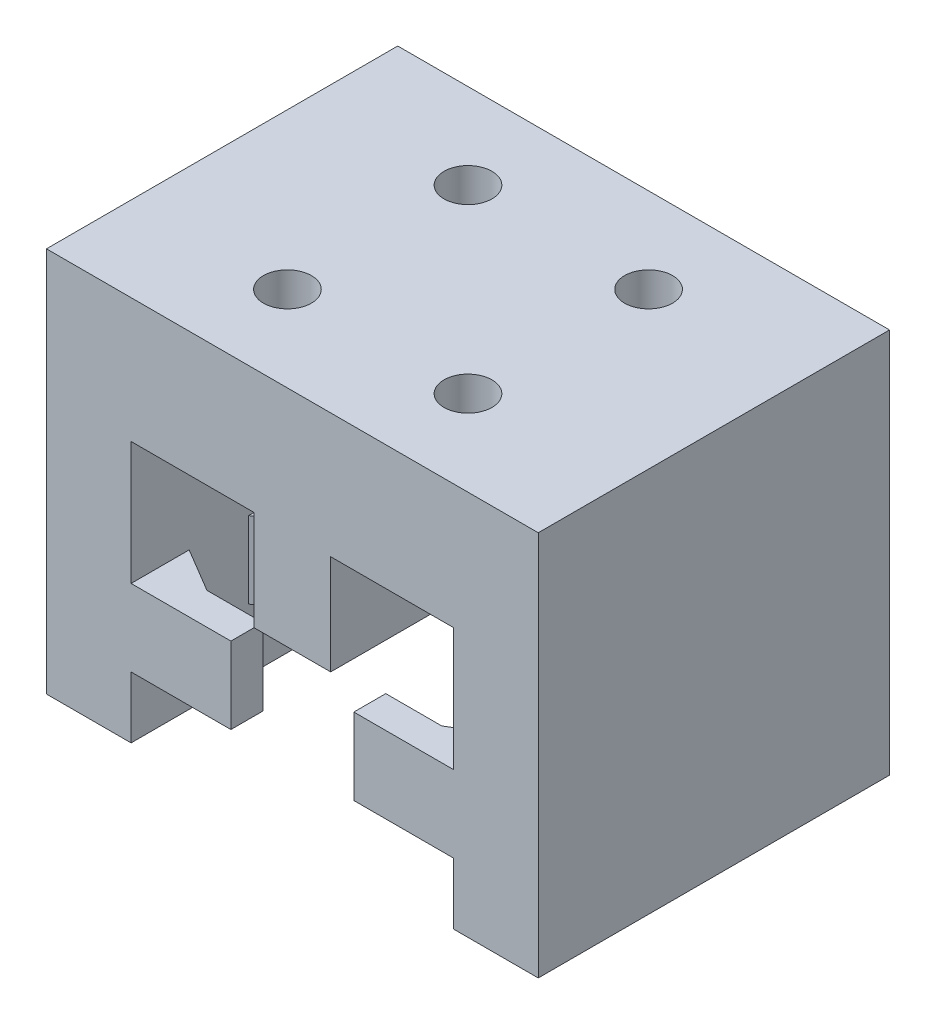
from build123d import *

# Parameters (mm, degrees)
ESQUISSE1_W                   = 30.8
ESQUISSE1_H                   = 24.15
BOSS_EXTRU_1_DEPTH            = 22
ENL_V_START                   = -22
ENL_V_MAT_EXTRU_2_DEPTH       = 22
ESQUISSE3_R                   = 1.5
ENL_V_MAT_EXTRU_3_DEPTH       = 4.4
ESQUISSE6_R                   = 3.2
ENL_V_MAT_EXTRU_6_DEPTH       = 3.4
ESQUISSE7_R                   = 3.2
ENL_V_MAT_EXTRU_7_DEPTH       = 3.4
ESQUISSE10_R                  = 3.2
ENL_V_MAT_EXTRU_10_DEPTH      = 3.4
ESQUISSE11_R                  = 3.2
ENL_V_MAT_EXTRU_11_DEPTH      = 3.4
ENL_V_MAT_EXTRU_14_DEPTH      = 47.950397903
ENL_V_MAT_EXTRU_14_DEPTH_BACK = 4.8
ENL_V_MAT_EXTRU_19_DEPTH      = 4.8
ENL_V_MAT_EXTRU_20_DEPTH      = 4.8
ENL_V_MAT_EXTRU_21_DEPTH      = 4.8


# Read off the part's stored shape, not the designer's step: Enlèv. mat.-Extru.2
with BuildPart() as part:
    # Esquisse1 → Boss.-Extru.1 (new body)
    with BuildSketch(Plane.XY):
        with Locations((-20.769736842, 6.111184211)):
            Rectangle(ESQUISSE1_W, ESQUISSE1_H)
    extrude(amount=BOSS_EXTRU_1_DEPTH)

    # Enlèv. mat.-Extru.2 outline → Enlèv. mat.-Extru.2 (cut)
    with BuildSketch(Plane.XY.offset(22).offset(ENL_V_START)):
        Polygon((-30.869736842, -5.963815789), (-10.669736842, -5.963815789), (-10.669736842, -2.113815789), (-16.919736842, -2.113815789), (-16.919736842, 2.686184211), (-10.669736842, 2.686184211), (-10.669736842, 10.386184211), (-18.369736842, 10.386184211), (-18.369736842, 4.136184211), (-23.169736842, 4.136184211), (-23.169736842, 10.386184211), (-30.869736842, 10.386184211), (-30.869736842, 2.686184211), (-24.619736842, 2.686184211), (-24.619736842, -2.113815789), (-30.869736842, -2.113815789), align=None)
    extrude(amount=ENL_V_MAT_EXTRU_2_DEPTH, mode=Mode.SUBTRACT)

    # Esquisse3 → Enlèv. mat.-Extru.3 (cut)
    with BuildSketch(Plane(origin=(0, 18.186184211, 0), x_dir=(1, 0, 0), z_dir=(0, 1, 0))):
        with Locations(Location((-26.424736842, -5.345, 0), (0, 0, 270))):
            Circle(ESQUISSE3_R)
        with Locations(Location((-15.114736842, -5.345, 0), (0, 0, 270))):
            Circle(ESQUISSE3_R)
        with Locations(Location((-26.424736842, -16.655, 0), (0, 0, 270))):
            Circle(ESQUISSE3_R)
        with Locations(Location((-15.114736842, -16.655, 0), (0, 0, 270))):
            Circle(ESQUISSE3_R)
    extrude(amount=-ENL_V_MAT_EXTRU_3_DEPTH, mode=Mode.SUBTRACT)

    # Esquisse6 → Enlèv. mat.-Extru.6 (cut)
    with BuildSketch(Plane(origin=(0, 13.786184211, 0), x_dir=(1, 0, 0), z_dir=(0, 1, 0))):
        with Locations(Location((-15.126255276, -16.627264665, 0), (0, 0, 270))):
            Circle(ESQUISSE6_R)
    extrude(amount=-ENL_V_MAT_EXTRU_6_DEPTH, mode=Mode.SUBTRACT)

    # Esquisse7 → Enlèv. mat.-Extru.7 (cut)
    with BuildSketch(Plane(origin=(0, 13.786184211, 0), x_dir=(1, 0, 0), z_dir=(0, 1, 0))):
        with Locations(Location((-26.44565221, -16.692132269, 0), (0, 0, 270))):
            Circle(ESQUISSE7_R)
    extrude(amount=-ENL_V_MAT_EXTRU_7_DEPTH, mode=Mode.SUBTRACT)

    # Esquisse10 → Enlèv. mat.-Extru.10 (cut)
    with BuildSketch(Plane(origin=(0, 13.786184211, 0), x_dir=(1, 0, 0), z_dir=(0, 1, 0))):
        with Locations(Location((-15.114736842, -5.345, 0), (0, 0, 270))):
            Circle(ESQUISSE10_R)
    extrude(amount=-ENL_V_MAT_EXTRU_10_DEPTH, mode=Mode.SUBTRACT)

    # Esquisse11 → Enlèv. mat.-Extru.11 (cut)
    with BuildSketch(Plane(origin=(0, 13.786184211, 0), x_dir=(1, 0, 0), z_dir=(0, 1, 0))):
        with Locations(Location((-26.424736842, -5.345, 0), (0, 0, 270))):
            Circle(ESQUISSE11_R)
    extrude(amount=-ENL_V_MAT_EXTRU_11_DEPTH, mode=Mode.SUBTRACT)

    # Esquisse12 → Enlèv. mat.-Extru.14 (cut, two sides: drawn at the far end of the back side and taken through both)
    with BuildSketch(Plane(origin=(0, -2.113815789, 0), x_dir=(-1, 0, 0), z_dir=(0, -1, 0)).offset(-ENL_V_MAT_EXTRU_14_DEPTH_BACK)):
        Polygon((16.919736842, -9), (16.919736842, -2), (13.419736842, -2), (10.669736842, -3.636306817), (10.669736842, -7.363693183), (13.419736842, -9), align=None)
    extrude(amount=ENL_V_MAT_EXTRU_14_DEPTH + ENL_V_MAT_EXTRU_14_DEPTH_BACK, mode=Mode.SUBTRACT)

    # Esquisse13 → Enlèv. mat.-Extru.19 (cut)
    with BuildSketch(Plane(origin=(0, -2.113815789, 0), x_dir=(-1, 0, 0), z_dir=(0, -1, 0))):
        Polygon((24.619736842, -2), (28.119736842, -2), (30.869736842, -3.636306817), (30.869736842, -7.363693183), (28.119736842, -9), (24.619736842, -9), align=None)
    extrude(amount=-ENL_V_MAT_EXTRU_19_DEPTH, mode=Mode.SUBTRACT)

    # Esquisse14 → Enlèv. mat.-Extru.20 (cut)
    with BuildSketch(Plane(origin=(0, -2.113815789, 0), x_dir=(-1, 0, 0), z_dir=(0, -1, 0))):
        Polygon((24.619736842, -20), (28.119736842, -20), (30.869736842, -18.363693183), (30.869736842, -14.636306817), (28.119736842, -13), (24.619736842, -13), align=None)
    extrude(amount=-ENL_V_MAT_EXTRU_20_DEPTH, mode=Mode.SUBTRACT)

    # Esquisse16 → Enlèv. mat.-Extru.21 (cut)
    with BuildSketch(Plane(origin=(0, -2.113815789, 0), x_dir=(-1, 0, 0), z_dir=(0, -1, 0))):
        Polygon((16.919736842, -20), (13.419736842, -20), (10.669736842, -18.363693183), (10.669736842, -14.636306817), (13.419736842, -13), (16.919736842, -13), align=None)
    extrude(amount=-ENL_V_MAT_EXTRU_21_DEPTH, mode=Mode.SUBTRACT)


solid = part.part
